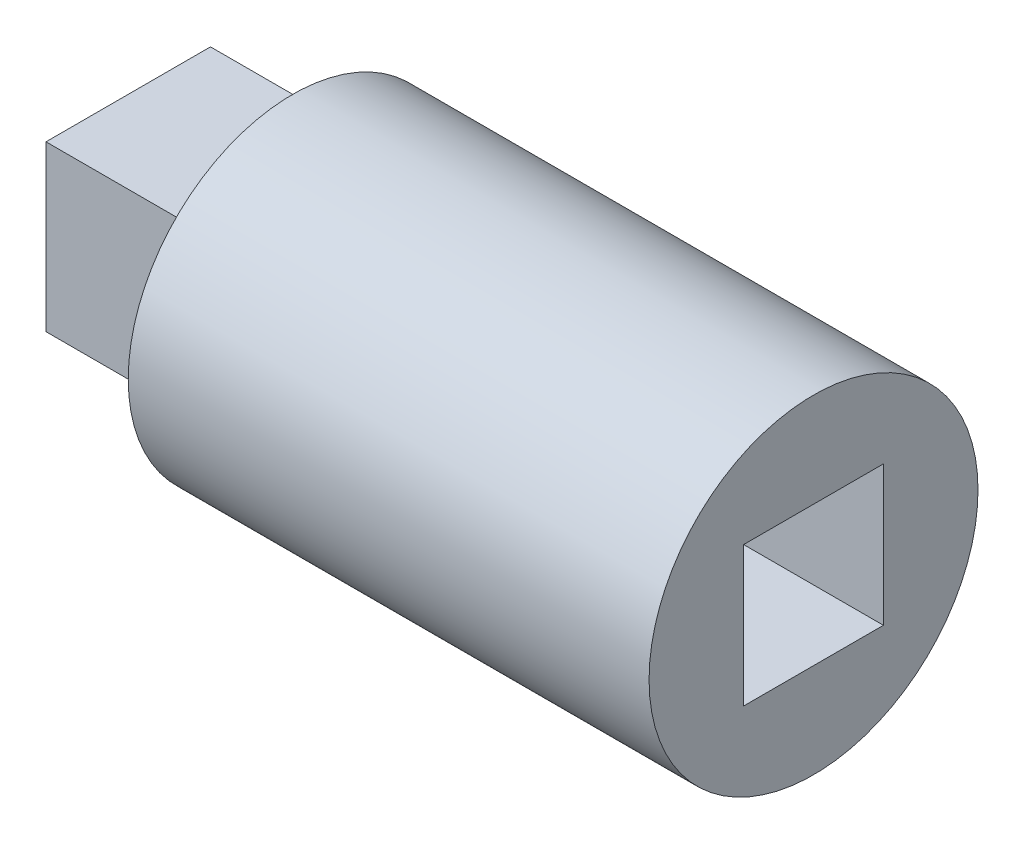
from build123d import *

# Parameters (mm, degrees)
STOCK_STICK_1_START       = -19
STOCK_STICK_1_OUTLINE_R   = 6
STOCK_STICK_1_DEPTH       = 19
STOCK_STICK_1_START_2     = -25
STOCK_STICK_1_2_OUTLINE_W = 6
STOCK_STICK_1_2_OUTLINE_H = 6
STOCK_STICK_1_2_DEPTH     = 6
SKETCH1_W                 = 5.1
SKETCH1_H                 = 5.1
CUT_EXTRUDE1_DEPTH        = 7


# Read off the part's stored shape, not the designer's step: Stock-Stick-1
with BuildPart() as part:
    # Stock-Stick-1 outline → Stock-Stick-1 (new body)
    with BuildSketch(Plane.YZ.offset(STOCK_STICK_1_START)):
        Circle(STOCK_STICK_1_OUTLINE_R)
    extrude(amount=STOCK_STICK_1_DEPTH)

    # Stock-Stick-1 2 outline → Stock-Stick-1 2 (add)
    with BuildSketch(Plane.YZ.offset(STOCK_STICK_1_START_2)):
        Rectangle(STOCK_STICK_1_2_OUTLINE_W, STOCK_STICK_1_2_OUTLINE_H)
    extrude(amount=STOCK_STICK_1_2_DEPTH)

    # Sketch1 → Cut-Extrude1 (cut)
    with BuildSketch(Plane(origin=(0, 0, 0), x_dir=(0, 0, -1), z_dir=(1, 0, 0))):
        Rectangle(SKETCH1_W, SKETCH1_H)
    extrude(amount=-CUT_EXTRUDE1_DEPTH, mode=Mode.SUBTRACT)


solid = part.part
